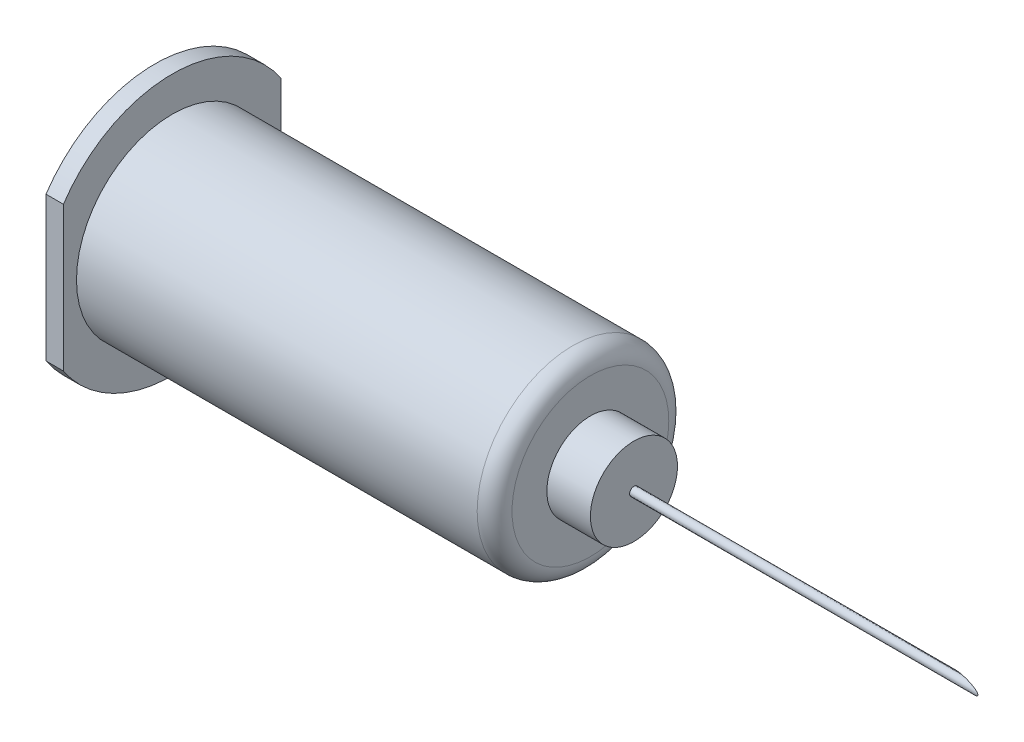
from build123d import *

# Parameters (mm, degrees)
CROQUIS2_R              = 11
SALIENTE_EXTRUIR1_DEPTH = 50
REDONDEO1_R             = 2
CROQUIS4_R              = 5
SALIENTE_EXTRUIR2_DEPTH = 5
CROQUIS5_R              = 0.5
SALIENTE_EXTRUIR3_DEPTH = 40
SALIENTE_EXTRUIR4_START = 25
CROQUIS6_R              = 0.5
SALIENTE_EXTRUIR4_DEPTH = 25
CORTAR_EXTRUIR2_DEPTH   = 12.5
CROQUIS8_R              = 0.4
CORTAR_EXTRUIR3_DEPTH   = 72
CROQUIS9_R              = 10
SALIENTE_EXTRUIR5_DEPTH = 2


# Read off the part's stored shape, not the designer's step: Vaciado1
with BuildPart() as part:
    # Croquis2 → Saliente-Extruir1 (new body)
    with BuildSketch(Plane(origin=(0, 0, 0), x_dir=(0, 0, -1), z_dir=(1, 0, 0))):
        Circle(CROQUIS2_R)
    extrude(amount=SALIENTE_EXTRUIR1_DEPTH)

    # Redondeo1
    redondeo1_edges = [part.edges().sort_by_distance(p)[0] for p in [
        (50, 0, 11),
    ]]
    fillet(redondeo1_edges, radius=REDONDEO1_R)

    # Croquis4 → Saliente-Extruir2 (add)
    with BuildSketch(Plane(origin=(50, 0, 0), x_dir=(0, 0, -1), z_dir=(1, 0, 0))):
        Circle(CROQUIS4_R)
    extrude(amount=SALIENTE_EXTRUIR2_DEPTH)

    # Croquis5 → Saliente-Extruir3 (add)
    with BuildSketch(Plane(origin=(55, 0, 0), x_dir=(0, 0, -1), z_dir=(1, 0, 0))):
        Circle(CROQUIS5_R)
    extrude(amount=SALIENTE_EXTRUIR3_DEPTH)

    # Vaciado1 outline → Vaciado1 (revolve, cut)
    with BuildSketch(Plane.YX):
        with BuildLine():
            Line((10, 0), (10, 48))
            ThreePointArc((10, 48), (9.707106781, 48.707106781), (9, 49))
            Line((9, 49), (4, 49))
            Line((4, 49), (4, 54))
            Line((4, 54), (0, 54))
            Line((0, 54), (0, 0))
            Line((0, 0), (10, 0))
        make_face()
    revolve(axis=Axis((0, 0, 0), (1, 0, 0)), mode=Mode.SUBTRACT)

    # Croquis6 → Saliente-Extruir4 (add)
    with BuildSketch(Plane.ZY.offset(-54).offset(SALIENTE_EXTRUIR4_START)):
        with Locations(Location((0, 0, 0), (0, 0, 180))):
            Circle(CROQUIS6_R)
    extrude(amount=-SALIENTE_EXTRUIR4_DEPTH)

    # Croquis7 → Cortar-Extruir2 (cut, symmetric)
    with BuildSketch(Plane(origin=(0, 0, 0), x_dir=(1, 0, 0), z_dir=(0, 1, 0))):
        Polygon((95, -0.5), (91.022583164, 0.5), (95, 0.5), align=None)
    extrude(amount=CORTAR_EXTRUIR2_DEPTH, both=True, mode=Mode.SUBTRACT)

    # Croquis8 → Cortar-Extruir3 (cut)
    with BuildSketch(Plane.ZY.offset(-29)):
        Circle(CROQUIS8_R)
    extrude(amount=-CORTAR_EXTRUIR3_DEPTH, mode=Mode.SUBTRACT)


with BuildPart() as body_2:
    # Croquis9 → Saliente-Extruir5 (new body)
    with BuildSketch(Plane(origin=(0, 0, 0), x_dir=(0, 0, -1), z_dir=(1, 0, 0))):
        with BuildLine():
            Line((12.5, -8.291561976), (12.5, 8.291561976))
            ThreePointArc((12.5, 8.291561976), (0, 15), (-12.5, 8.291561976))
            Line((-12.5, 8.291561976), (-12.5, -8.291561976))
            ThreePointArc((-12.5, -8.291561976), (0, -15), (12.5, -8.291561976))
        make_face()
        Circle(CROQUIS9_R, mode=Mode.SUBTRACT)
    extrude(amount=SALIENTE_EXTRUIR5_DEPTH)


solid = Compound([part.part, body_2.part])
